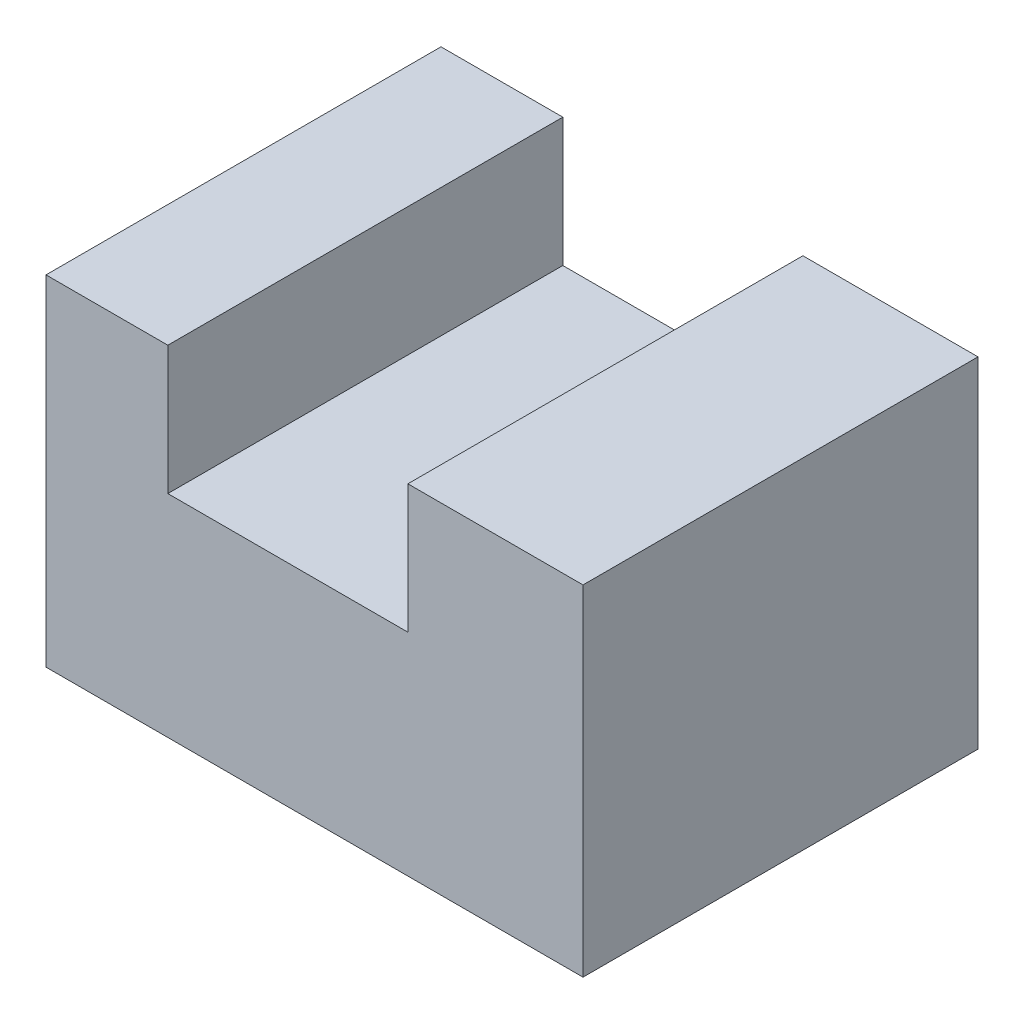
from build123d import *

# Parameters (mm, degrees)
SKETCH_1_W          = 52.162890579
SKETCH_1_H          = 38.368703959
EXTRUDE_1_DEPTH     = 33
SKETCH_2_W          = 23.318490967
SKETCH_2_H          = 12.481057266
CUT_EXTRUDE_1_DEPTH = 43


with BuildPart() as part:
    # ｽｹｯﾁ1 → ﾎﾞｽ - 押し出し1 (new body)
    with BuildSketch(Plane(origin=(0, 0, 0), x_dir=(1, 0, 0), z_dir=(0, 1, 0))):
        with Locations((27.472455704, 19.18435198)):
            Rectangle(SKETCH_1_W, SKETCH_1_H)
    extrude(amount=EXTRUDE_1_DEPTH)

    # ｽｹｯﾁ2 → ｶｯﾄ - 押し出し1 (cut)
    with BuildSketch(Plane.XY):
        with Locations((24.884442466, 26.759471367)):
            Rectangle(SKETCH_2_W, SKETCH_2_H)
    extrude(amount=-CUT_EXTRUDE_1_DEPTH, mode=Mode.SUBTRACT)


solid = part.part
